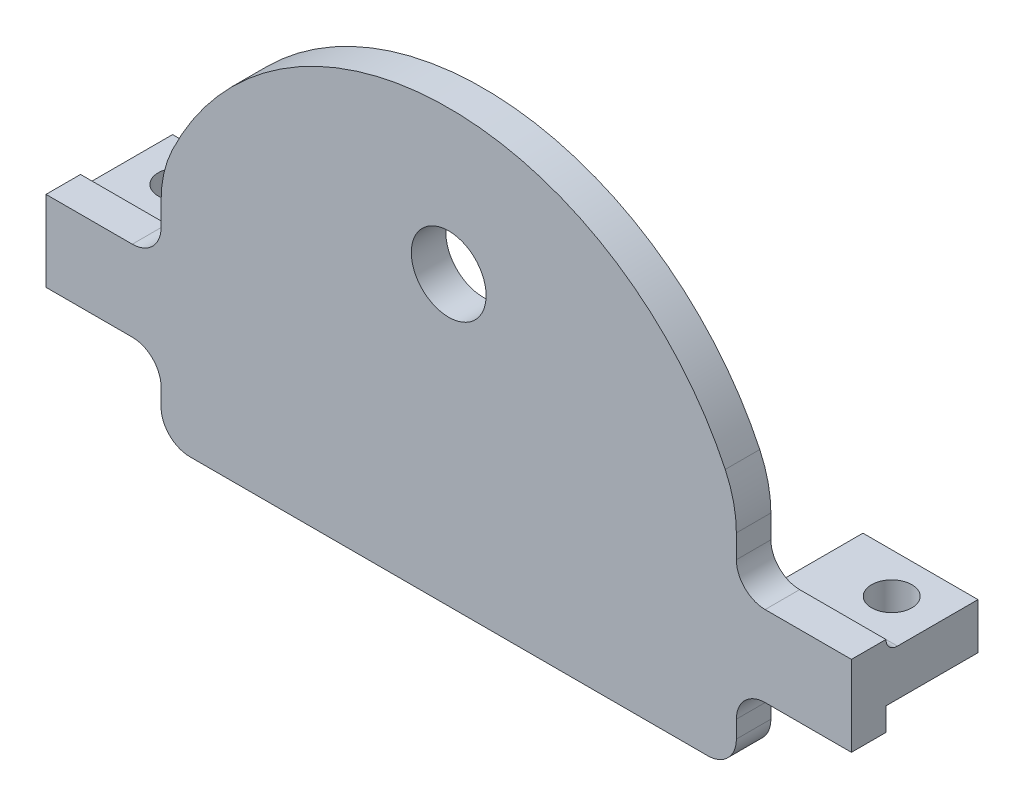
from build123d import *

# Parameters (mm, degrees)
SKETCH1_W           = 20
SKETCH1_H           = 155
BOSS_EXTRUDE1_DEPTH = 4
SKETCH2_W           = 20
SKETCH2_H           = 4
BOSS_EXTRUDE3_DEPTH = 50
RIB2_REACH          = 96.986
SKETCH7_WALL_W      = 290.205463948
SKETCH7_WALL_H      = 4
SKETCH8_W           = 20
SKETCH8_H           = 3
BOSS_EXTRUDE4_DEPTH = 3.5
SKETCH9_W           = 70
SKETCH9_H           = 5
BOSS_EXTRUDE6_DEPTH = 3
SKETCH10_W          = 10
SKETCH10_H          = 4
BOSS_EXTRUDE7_DEPTH = 8
SKETCH12_R          = 1.75
CUT_EXTRUDE1_DEPTH  = 10
SKETCH13_W          = 111.319070758
SKETCH13_H          = 99.743885808
CUT_EXTRUDE2_DEPTH  = 152
SKETCH14_W          = 50
SKETCH14_H          = 3
BOSS_EXTRUDE8_DEPTH = 6.5
FILLET1_R           = 1
FILLET2_R           = 2.5
SKETCH15_R          = 3.25
BOSS_EXTRUDE9_DEPTH = 3
FILLET3_R           = 10


with BuildPart() as part:
    # Sketch1 → Boss-Extrude1 (new body)
    with BuildSketch(Plane.XY):
        Rectangle(SKETCH1_W, SKETCH1_H)
    extrude(amount=BOSS_EXTRUDE1_DEPTH)

    # Sketch2 → Boss-Extrude3 (add)
    with BuildSketch(Plane.XY.offset(4)):
        with Locations((0, -75.5)):
            Rectangle(SKETCH2_W, SKETCH2_H)
    extrude(amount=BOSS_EXTRUDE3_DEPTH)

    # Sketch7 wall → Rib2 (add, up to next)
    with BuildSketch(Plane(origin=(0, -26, 16.5), x_dir=(0, 0.967074537263, -0.25449329928), z_dir=(0, 0.25449329928, 0.967074537263)), mode=Mode.PRIVATE) as rib2_sk1:
        Rectangle(SKETCH7_WALL_W, SKETCH7_WALL_H)
    rib2_tool1 = extrude(rib2_sk1.sketch, amount=-RIB2_REACH, mode=Mode.PRIVATE) - part.part
    add(rib2_tool1.solids().sort_by_distance((0, -26, 16.5))[0])

    # Sketch8 → Boss-Extrude4 (add)
    with BuildSketch(Plane.XY.offset(4)):
        with Locations((0, 76)):
            Rectangle(SKETCH8_W, SKETCH8_H)
    extrude(amount=BOSS_EXTRUDE4_DEPTH)

    # Sketch9 → Boss-Extrude6 (add)
    with BuildSketch(Plane.XY.offset(7.5)):
        with Locations((0, 77)):
            Rectangle(SKETCH9_W, SKETCH9_H)
    boss_extrude6 = extrude(amount=BOSS_EXTRUDE6_DEPTH)

    # Sketch10 → Boss-Extrude7 (add)
    with BuildSketch(Plane(origin=(0, 0, 7.5), x_dir=(-1, 0, 0), z_dir=(0, 0, -1))):
        with Locations((30, 76.5)):
            Rectangle(SKETCH10_W, SKETCH10_H)
        with Locations((-30, 76.5)):
            Rectangle(SKETCH10_W, SKETCH10_H)
    extrude(amount=BOSS_EXTRUDE7_DEPTH)

    # Sketch12 → Cut-Extrude1 (cut)
    with BuildSketch(Plane(origin=(0, 78.5, 0), x_dir=(1, 0, 0), z_dir=(0, 1, 0))):
        with Locations(Location((-31, -3, 0), (0, 0, 270))):
            Circle(SKETCH12_R)
        with Locations(Location((31, -3, 0), (0, 0, 270))):
            Circle(SKETCH12_R)
    extrude(amount=-CUT_EXTRUDE1_DEPTH, mode=Mode.SUBTRACT)

    # Sketch13 → Cut-Extrude2 (cut)
    with BuildSketch(Plane.XZ.offset(77.5)):
        with Locations((2.652852139, 20.474703111)):
            Rectangle(SKETCH13_W, SKETCH13_H)
    extrude(amount=-CUT_EXTRUDE2_DEPTH, mode=Mode.SUBTRACT)

    # Sketch14 → Boss-Extrude8 (add)
    with BuildSketch(Plane(origin=(0, 79.5, 0), x_dir=(1, 0, 0), z_dir=(0, 1, 0))):
        with Locations((0, -9)):
            Rectangle(SKETCH14_W, SKETCH14_H)
    boss_extrude8 = extrude(amount=BOSS_EXTRUDE8_DEPTH)

    # Mirror1: Boss-Extrude6, Boss-Extrude8 across plane
    add(boss_extrude6.mirror(Plane(origin=(0, 76, 0), x_dir=(0, 0, 1), z_dir=(0, -1, 0))))
    add(boss_extrude8.mirror(Plane(origin=(0, 76, 0), x_dir=(0, 0, 1), z_dir=(0, -1, 0))))

    # Fillet1
    fillet1_edges = [part.edges().sort_by_distance(p)[0] for p in [
        (30, 78.5, 7.5),
        (-30, 78.5, 7.5),
        (10, 76, 7.5),
        (-10, 76, 7.5),
        (0, 77.5, 7.5),
        (25, 76.5, 7.5),
        (-25, 76.5, 7.5),
    ]]
    fillet(fillet1_edges, radius=FILLET1_R - 0.0001)  # a hair under: the kernel refuses the full size

    # Fillet2
    fillet2_edges = [part.edges().sort_by_distance(p)[0] for p in [
        (-25, 79.5, 9),
        (25, 79.5, 9),
        (-25, 66, 9),
        (25, 66, 9),
        (-25, 72.5, 9),
        (25, 72.5, 9),
    ]]
    fillet(fillet2_edges, radius=FILLET2_R)

    # Sketch15 → Boss-Extrude9 (add)
    with BuildSketch(Plane(origin=(0, 0, 7.5), x_dir=(-1, 0, 0), z_dir=(0, 0, -1))):
        with BuildLine():
            Line((25, 86), (-25, 86))
            ThreePointArc((-25, 86), (0, 103.502), (25, 86))
        make_face()
        with Locations((0, 91.001)):
            Circle(SKETCH15_R, mode=Mode.SUBTRACT)
    extrude(amount=-BOSS_EXTRUDE9_DEPTH)

    # Fillet3
    fillet3_edges = [part.edges().sort_by_distance(p)[0] for p in [
        (-25, 86, 9),
        (25, 86, 9),
    ]]
    fillet(fillet3_edges, radius=FILLET3_R)


solid = part.part
